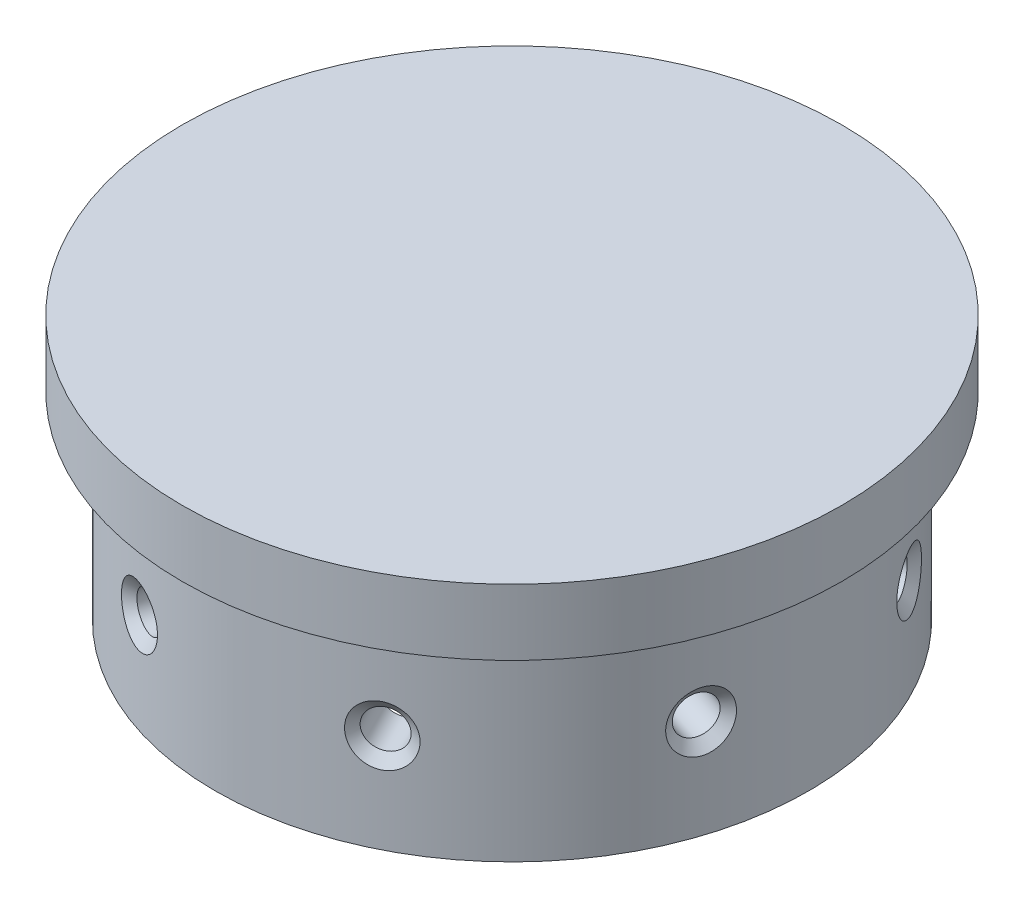
from build123d import *

# Parameters (mm, degrees)
SKETCH1_R           = 28.575
SKETCH1_R_2         = 23.495
BOSS_EXTRUDE1_DEPTH = 19.05
CIRPATTERN1_COUNT   = 8
SKETCH4_R           = 31.75
BOSS_EXTRUDE2_DEPTH = 6.35


# Read off the part's stored shape, not the designer's step: CSK for #4 Flat Head Machine Screw (100)1
with BuildPart() as part:
    # Sketch1 → Boss-Extrude1 (new body)
    with BuildSketch(Plane(origin=(0, 0, 0), x_dir=(1, 0, 0), z_dir=(0, 1, 0))):
        with Locations(Location((0, 0, 0), (0, 0, 90))):
            Circle(SKETCH1_R)
        with Locations(Location((0, 0, 0), (0, 0, 90))):
            Circle(SKETCH1_R_2, mode=Mode.SUBTRACT)
    extrude(amount=BOSS_EXTRUDE1_DEPTH)

    # CSK for _4 Flat Head Machine Screw _ 2 → CSK for #4 Flat Head Machine Screw (100)1 (revolve, cut)
    with BuildSketch(Plane(origin=(0, 9.525, 0), x_dir=(0.8917116917963323, 0, -0.45260386511133904), z_dir=(0, -1, 0))):
        Polygon((2.857586854, 28.575072879), (0, 28.575072879), (0, 23.423678509), (1.8288, 23.423678509), (1.8288, 27.711818209), align=None)
    csk_for_4_flat_head_machine_screw_100 = revolve(axis=Axis((0, 9.525, 0), (0.45260386511133904, 0, 0.8917116917963323)), mode=Mode.SUBTRACT)

    # CirPattern1: CSK for #4 Flat Head Machine Screw (100)1 ×8 about axis
    cirpattern1_axis = Axis((0, 19.05, 0), (0, -1, 0))
    for i in range(1, CIRPATTERN1_COUNT):
        add(csk_for_4_flat_head_machine_screw_100.rotate(cirpattern1_axis, i * 360 / CIRPATTERN1_COUNT), mode=Mode.SUBTRACT)

    # Sketch4 → Boss-Extrude2 (add)
    with BuildSketch(Plane(origin=(0, 19.05, 0), x_dir=(1, 0, 0), z_dir=(0, 1, 0))):
        with Locations(Location((0, 0, 0), (0, 0, 270))):
            Circle(SKETCH4_R)
    extrude(amount=BOSS_EXTRUDE2_DEPTH)


solid = part.part
